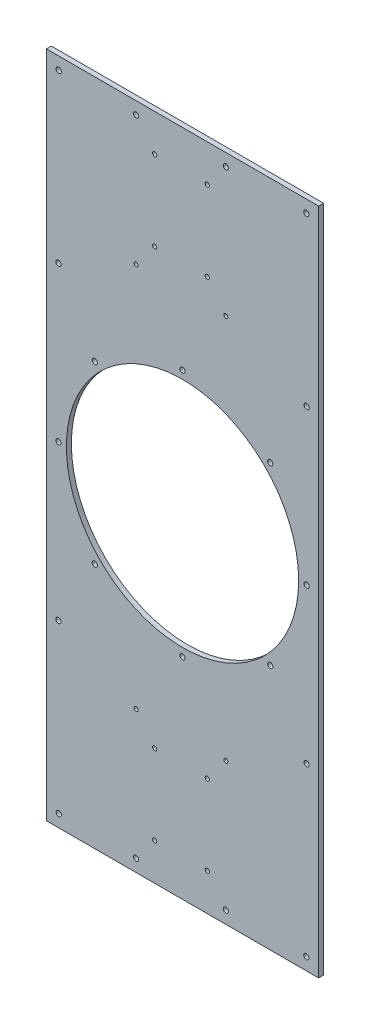
from build123d import *

# Parameters (mm, degrees)
SKETCH_1_W          = 220
SKETCH_1_H          = 540
EXTRUDE_1_DEPTH     = 4
SKETCH_2_R          = 2.1
CUT_EXTRUDE_1_DEPTH = 292.575033225
SKETCH_4_R          = 93.8
CUT_EXTRUDE_2_DEPTH = 10
SKETCH_5_R          = 2.1
CUT_EXTRUDE_3_DEPTH = 10
SKETCH_6_R          = 1.65
SKETCH_6_R_2        = 1.7
CUT_EXTRUDE_5_DEPTH = 292.575033225


with BuildPart() as part:
    # 草图1 → 凸台-拉伸1 (new body)
    with BuildSketch(Plane.XY):
        Rectangle(SKETCH_1_W, SKETCH_1_H)
    extrude(amount=EXTRUDE_1_DEPTH)

    # 草图2 → 切除-拉伸1 (cut, through all)
    with BuildSketch(Plane(origin=(0, 0, 0), x_dir=(-1, 0, 0), z_dir=(0, 0, -1))):
        with Locations((100, -260)):
            Circle(SKETCH_2_R)
        with Locations((-100, -260)):
            Circle(SKETCH_2_R)
        with Locations((100, 260)):
            Circle(SKETCH_2_R)
        with Locations((-100, 260)):
            Circle(SKETCH_2_R)
        with Locations((-35, -260)):
            Circle(SKETCH_2_R)
        with Locations((-35, 260)):
            Circle(SKETCH_2_R)
        with Locations((37.5, 260)):
            Circle(SKETCH_2_R)
        with Locations((37.5, -260)):
            Circle(SKETCH_2_R)
    extrude(amount=-CUT_EXTRUDE_1_DEPTH, mode=Mode.SUBTRACT)

    # 草图4 → 切除-拉伸2 (cut)
    with BuildSketch(Plane.XY.offset(4)):
        Circle(SKETCH_4_R)
    extrude(amount=-CUT_EXTRUDE_2_DEPTH, mode=Mode.SUBTRACT)

    # 草图5 → 切除-拉伸3 (cut)
    with BuildSketch(Plane.XY.offset(4)):
        with Locations((-100.25, 0)):
            Circle(SKETCH_5_R)
        with Locations((-70.887454814, 70.887454814)):
            Circle(SKETCH_5_R)
        with Locations((0, 100.25)):
            Circle(SKETCH_5_R)
        with Locations((70.887454814, 70.887454814)):
            Circle(SKETCH_5_R)
        with Locations((100.25, 0)):
            Circle(SKETCH_5_R)
        with Locations((70.887454814, -70.887454814)):
            Circle(SKETCH_5_R)
        with Locations((0, -100.25)):
            Circle(SKETCH_5_R)
        with Locations((-70.887454814, -70.887454814)):
            Circle(SKETCH_5_R)
        with Locations((-100.25, -125)):
            Circle(SKETCH_5_R)
        with Locations((100.25, -125)):
            Circle(SKETCH_5_R)
        with Locations((-100.25, 125)):
            Circle(SKETCH_5_R)
        with Locations((100.25, 125)):
            Circle(SKETCH_5_R)
    extrude(amount=-CUT_EXTRUDE_3_DEPTH, mode=Mode.SUBTRACT)

    # 草图6 → 切除-拉伸5 (cut, through all)
    with BuildSketch(Plane(origin=(0, 0, 0), x_dir=(-1, 0, 0), z_dir=(0, 0, -1))):
        with Locations((37.5, 155.525642791)):
            Circle(SKETCH_6_R)
        with Locations((22.5, 175.525642791)):
            Circle(SKETCH_6_R_2)
        with Locations((-20, 175.525642791)):
            Circle(SKETCH_6_R_2)
        with Locations((-35, 155.525642791)):
            Circle(SKETCH_6_R)
        with Locations((-20, 240)):
            Circle(SKETCH_6_R_2)
        with Locations((22.5, 240)):
            Circle(SKETCH_6_R_2)
    cut_extrude_5 = extrude(amount=-CUT_EXTRUDE_5_DEPTH, mode=Mode.SUBTRACT)

    # 镜向1: 切除-拉伸5 across plane
    add(cut_extrude_5.mirror(Plane.ZX), mode=Mode.SUBTRACT)


solid = part.part
